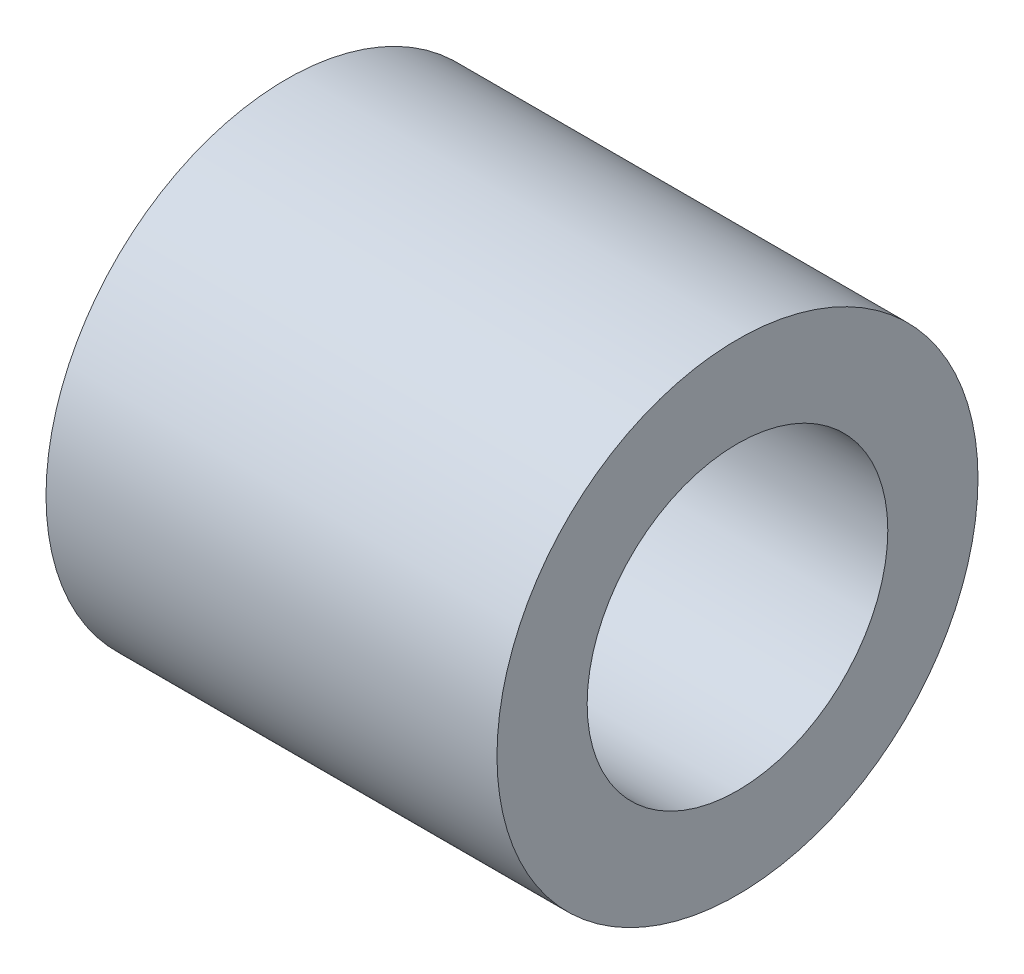
from build123d import *

# Parameters (mm, degrees)
SKETCH1_R           = 8
SKETCH1_R_2         = 5
BOSS_EXTRUDE1_DEPTH = 15


with BuildPart() as part:
    # Sketch1 → Boss-Extrude1 (new body)
    with BuildSketch(Plane(origin=(0, 0, 0), x_dir=(0, 0, -1), z_dir=(1, 0, 0))):
        Circle(SKETCH1_R)
        Circle(SKETCH1_R_2, mode=Mode.SUBTRACT)
    extrude(amount=BOSS_EXTRUDE1_DEPTH)


solid = part.part
